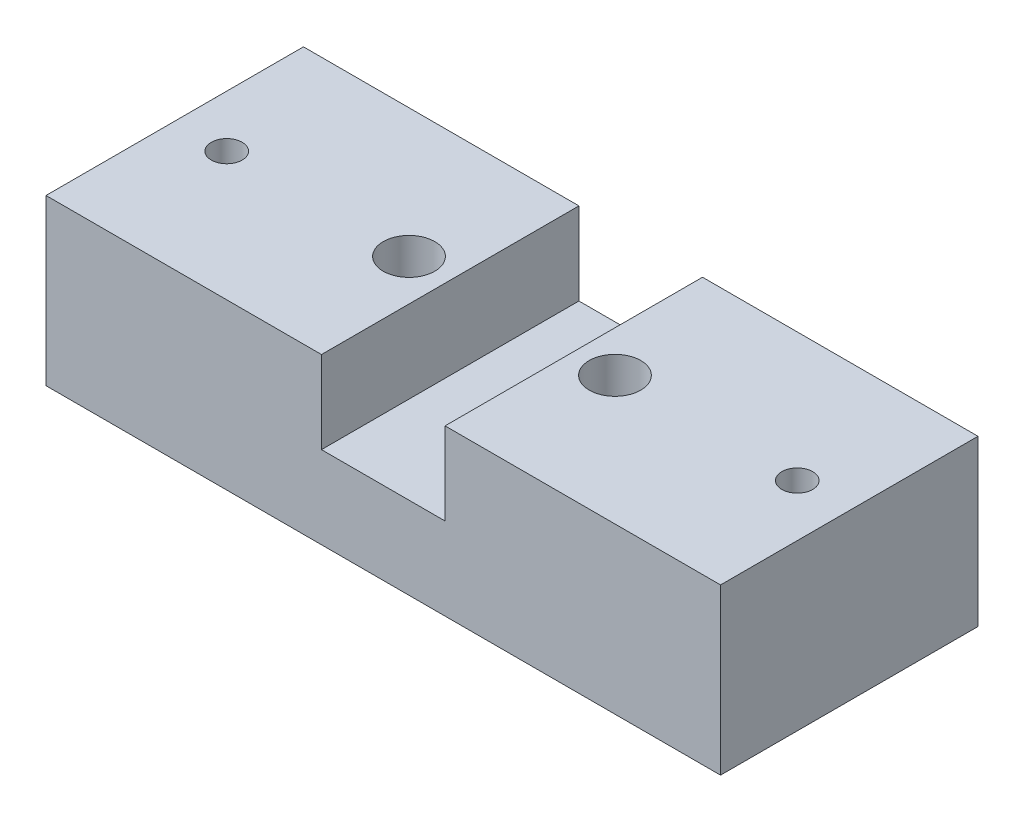
from build123d import *

# Parameters (mm, degrees)
BOSS_EXTRUDE1_DEPTH   = 25
F_3_0MM_DOWEL_HOLE1_D = 3
SKETCH5_R             = 5
CUT_EXTRUDE1_DEPTH    = 4
F_5_0MM_DOWEL_HOLE1_D = 5


with BuildPart() as part:
    # Sketch1 → Boss-Extrude1 (new body)
    with BuildSketch(Plane.XY):
        Polygon((26.75, 16), (26.75, 8), (38.75, 8), (38.75, 16), (65.5, 16), (65.5, 0), (0, 0), (0, 16), align=None)
    extrude(amount=BOSS_EXTRUDE1_DEPTH)

    # Ø3.0mm Dowel Hole1 (through all)
    with Locations(Plane(origin=(0, 16, 0), x_dir=(1, 0, 0), z_dir=(0, 1, 0))):
        with Locations((5.05, -12.5), (60.45, -12.5)):
            Hole(F_3_0MM_DOWEL_HOLE1_D / 2)

    # Sketch5 → Cut-Extrude1 (cut)
    with BuildSketch(Plane(origin=(0, 0, 0), x_dir=(1, 0, 0), z_dir=(0, 1, 0))):
        with Locations((50.65, -13)):
            Circle(SKETCH5_R)
        with Locations((14.45, -13)):
            Circle(SKETCH5_R)
    extrude(amount=CUT_EXTRUDE1_DEPTH, mode=Mode.SUBTRACT)

    # Ø5.0mm Dowel Hole1 (through all)
    with Locations(Plane(origin=(0, 16, 0), x_dir=(1, 0, 0), z_dir=(0, 1, 0))):
        with Locations((42.75, -12.5), (22.75, -12.5)):
            Hole(F_5_0MM_DOWEL_HOLE1_D / 2)


solid = part.part
